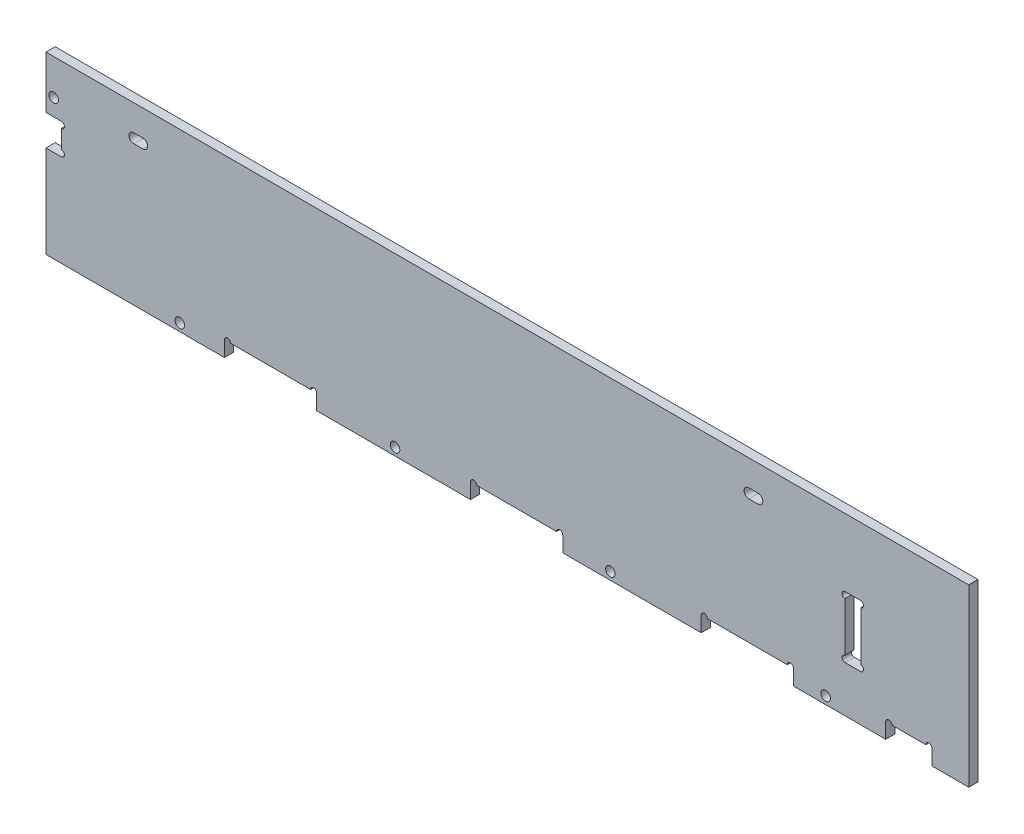
from build123d import *

# Parameters (mm, degrees)
SKETCH_1_W          = 300
SKETCH_1_H          = 57
EXTRUDE_1_DEPTH     = 3
SKETCH_2_W          = 5
SKETCH_2_H          = 10
SKETCH_2_W_2        = 30
SKETCH_2_H_2        = 5
SKETCH_2_W_3        = 15
SKETCH_2_H_3        = 20
CUT_EXTRUDE_1_DEPTH = 5
SKETCH_3_R          = 1
CUT_EXTRUDE_2_DEPTH = 5
SKETCH_4_R          = 1.55
CUT_EXTRUDE_3_DEPTH = 10
SKETCH_7_W          = 5.2
SKETCH_7_H          = 17.800678523
CUT_EXTRUDE_5_DEPTH = 10
CUT_EXTRUDE_6_DEPTH = 10


with BuildPart() as part:
    # 스케치1 → 보스-돌출1 (new body)
    with BuildSketch(Plane.XY):
        with Locations((150, 28.5)):
            Rectangle(SKETCH_1_W, SKETCH_1_H)
    extrude(amount=EXTRUDE_1_DEPTH)

    # 스케치2 → 컷-돌출1 (cut)
    with BuildSketch(Plane.XY.offset(3)):
        with Locations((2.5, 35)):
            Rectangle(SKETCH_2_W, SKETCH_2_H)
        with Locations((73, 2.5)):
            Rectangle(SKETCH_2_W_2, SKETCH_2_H_2)
        with Locations((153, 2.5)):
            Rectangle(SKETCH_2_W_2, SKETCH_2_H_2)
        with Locations((228, 2.5)):
            Rectangle(SKETCH_2_W_2, SKETCH_2_H_2)
        with Locations((280.5, 2.5)):
            Rectangle(SKETCH_2_W_3, SKETCH_2_H_2)
        with Locations((262.3, 25)):
            Rectangle(SKETCH_2_W, SKETCH_2_H_3)
    extrude(amount=-CUT_EXTRUDE_1_DEPTH, mode=Mode.SUBTRACT)

    # 스케치3 → 컷-돌출2 (cut)
    with BuildSketch(Plane.XY.offset(3)):
        with Locations((274, 5)):
            Circle(SKETCH_3_R)
        with Locations((287, 5)):
            Circle(SKETCH_3_R)
        with Locations((259.8, 16)):
            Circle(SKETCH_3_R)
        with Locations((264.8, 16)):
            Circle(SKETCH_3_R)
        with Locations((264.8, 34)):
            Circle(SKETCH_3_R)
        with Locations((259.8, 34)):
            Circle(SKETCH_3_R)
        with Locations((214, 5)):
            Circle(SKETCH_3_R)
        with Locations((242, 5)):
            Circle(SKETCH_3_R)
        with Locations((87, 5)):
            Circle(SKETCH_3_R)
        with Locations((139, 5)):
            Circle(SKETCH_3_R)
        with Locations((167, 5)):
            Circle(SKETCH_3_R)
        with Locations((5, 31)):
            Circle(SKETCH_3_R)
        with Locations((5, 39)):
            Circle(SKETCH_3_R)
        with Locations((59, 5)):
            Circle(SKETCH_3_R)
    extrude(amount=-CUT_EXTRUDE_2_DEPTH, mode=Mode.SUBTRACT)

    # 스케치4 → 컷-돌출3 (cut)
    with BuildSketch(Plane(origin=(0, 0, 0), x_dir=(-1, 0, 0), z_dir=(0, 0, -1))):
        with Locations((-253.478741621, 2.5)):
            Circle(SKETCH_4_R)
        with Locations((-183.478741621, 2.5)):
            Circle(SKETCH_4_R)
        with Locations((-113.478741621, 2.5)):
            Circle(SKETCH_4_R)
        with Locations((-43.478741621, 2.5)):
            Circle(SKETCH_4_R)
        with Locations((-2.5, 45.45)):
            Circle(SKETCH_4_R)
    extrude(amount=-CUT_EXTRUDE_3_DEPTH, mode=Mode.SUBTRACT)

    # 스케치7 → 컷-돌출5 (cut)
    with BuildSketch(Plane.XY.offset(3)):
        with Locations((262.3, 25.010941884)):
            Rectangle(SKETCH_7_W, SKETCH_7_H)
    extrude(amount=-CUT_EXTRUDE_5_DEPTH, mode=Mode.SUBTRACT)

    # 스케치8 → 컷-돌출6 (cut)
    with BuildSketch(Plane.XY.offset(3)):
        with BuildLine():
            Line((28.5, 48.55), (31.5, 48.55))
            ThreePointArc((31.5, 48.55), (33.05, 47), (31.5, 45.45))
            Line((31.5, 45.45), (28.5, 45.45))
            ThreePointArc((28.5, 45.45), (26.95, 47), (28.5, 48.55))
        make_face()
        with BuildLine():
            Line((228.5, 48.55), (231.5, 48.55))
            ThreePointArc((231.5, 48.55), (233.05, 47), (231.5, 45.45))
            Line((231.5, 45.45), (228.5, 45.45))
            ThreePointArc((228.5, 45.45), (226.95, 47), (228.5, 48.55))
        make_face()
    extrude(amount=-CUT_EXTRUDE_6_DEPTH, mode=Mode.SUBTRACT)


solid = part.part
